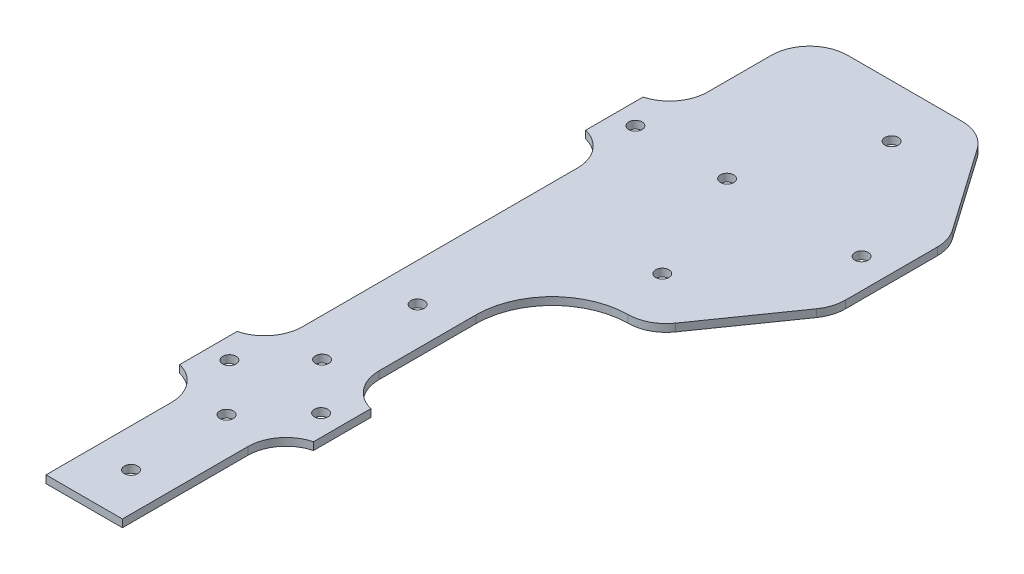
from build123d import *
from OCP.BRepFilletAPI import BRepFilletAPI_MakeChamfer

# Parameters (mm, degrees)
SCHIZZO1_R                   = 1.75
ESTRUSIONE_ESTRUSIONE1_DEPTH = 2
SMUSSO1_SIZE                 = 20
SMUSSO1_SIZE2                = 28.562960135
TAGLIO_ESTRUSIONE1_DEPTH     = 10
RACCORDO1_R                  = 10
RACCORDO2_R                  = 20


with BuildPart() as part:
    # Schizzo1 → Estrusione-Estrusione1 (new body)
    with BuildSketch(Plane(origin=(0, 0, 0), x_dir=(1, 0, 0), z_dir=(0, 1, 0))):
        Polygon((-10, -57.5), (-10, -100), (10, -100), (10, -57.5), (17.5, -57.5), (17.5, -42.5), (10, -42.5), (10, 12.5), (55, 12.5), (55, 100), (10, 100), (-10, 100), (-30, 100), (-30, 12.5), (-10, 12.5), (-10, -42.5), (-17.5, -42.5), (-17.5, -57.5), align=None)
        with Locations(Location((0, -87.75, 0), (0, 0, 270))):
            Circle(SCHIZZO1_R, mode=Mode.SUBTRACT)
        with Locations(Location((0, -62.75, 0), (0, 0, 270))):
            Circle(SCHIZZO1_R, mode=Mode.SUBTRACT)
        with Locations(Location((-12, -50, 0), (0, 0, 270))):
            Circle(SCHIZZO1_R, mode=Mode.SUBTRACT)
        with Locations(Location((0, -37.75, 0), (0, 0, 270))):
            Circle(SCHIZZO1_R, mode=Mode.SUBTRACT)
        with Locations(Location((12, -50, 0), (0, 0, 270))):
            Circle(SCHIZZO1_R, mode=Mode.SUBTRACT)
        with Locations(Location((0, -12.75, 0), (0, 0, 270))):
            Circle(SCHIZZO1_R, mode=Mode.SUBTRACT)
        with Locations(Location((-12, 56.25, 0), (0, 0, 270))):
            Circle(SCHIZZO1_R, mode=Mode.SUBTRACT)
        with Locations(Location((12, 56.25, 0), (0, 0, 270))):
            Circle(SCHIZZO1_R, mode=Mode.SUBTRACT)
        with Locations(Location((25.04, 26.25, 0), (0, 0, 270))):
            Circle(SCHIZZO1_R, mode=Mode.SUBTRACT)
        with Locations(Location((25.04, 86.25, 0), (0, 0, 270))):
            Circle(SCHIZZO1_R, mode=Mode.SUBTRACT)
        with Locations(Location((47.2, 56.25, 0), (0, 0, 270))):
            Circle(SCHIZZO1_R, mode=Mode.SUBTRACT)
    extrude(amount=-ESTRUSIONE_ESTRUSIONE1_DEPTH)

    # Smusso1: one chamfer whose edges measure the first distance from different faces: ONE call of the kernel's chamfer builder (chamfer() names one face for all edges)
    smusso1_edges_1 = [part.edges().sort_by_distance(p)[0] for p in [
        (55, -1, -12.5),
    ]]
    smusso1_side_1 = [part.faces().sort_by_distance(p)[0] for p in [
        (32.5, -1, -12.5),
    ]]
    smusso1_edges_2 = [part.edges().sort_by_distance(p)[0] for p in [
        (55, -1, -100),
    ]]
    smusso1_side_2 = [part.faces().sort_by_distance(p)[0] for p in [
        (12.5, -1, -100),
    ]]
    smusso1 = BRepFilletAPI_MakeChamfer(part.part.solid().wrapped)
    for e in smusso1_edges_1:
        smusso1.Add(SMUSSO1_SIZE, SMUSSO1_SIZE2, e.wrapped, smusso1_side_1[0].wrapped)  # the first distance lies on this face
    for e in smusso1_edges_2:
        smusso1.Add(SMUSSO1_SIZE, SMUSSO1_SIZE2, e.wrapped, smusso1_side_2[0].wrapped)  # the first distance lies on this face
    add(Compound.cast(smusso1.Shape()), mode=Mode.REPLACE)

    # Schizzo2 → Taglio-Estrusione1 (cut)
    with BuildSketch(Plane(origin=(0, 0, 0), x_dir=(1, 0, 0), z_dir=(0, 1, 0))):
        Polygon((-10, 12.5), (-10, 48.75), (-17.5, 48.75), (-17.5, 63.75), (-10.178518111, 63.75), (-10.178518111, 100), (-33.809151811, 100), (-33.809151811, 12.5), align=None)
    extrude(amount=-TAGLIO_ESTRUSIONE1_DEPTH, mode=Mode.SUBTRACT)

    # Raccordo1
    # the kernel refuses this fillet: 10 mm, written as the material it adds along each edge
    with BuildSketch(Plane(origin=(10, 0, 42.5), x_dir=(0, 0, -1), z_dir=(0, -1, 0)), Plane(origin=(-10, 0, 57.5), x_dir=(0, 0, 1), z_dir=(0, -1, 0)), Plane(origin=(-10, 0, -48.75), x_dir=(0, 0, 1), z_dir=(0, -1, 0))) as raccordo1_piece_1:
        with BuildLine():
            CenterArc((9.682458366, 10), RACCORDO1_R, 194.477512186, 75.522487814)
            Line((0, 7.5), (0, 0))
            Line((0, 0), (9.682458366, 0))
        make_face()
    extrude(amount=2)
    with BuildSketch(Plane(origin=(-10, 0, 42.5), x_dir=(-1, 0, 0), z_dir=(0, -1, 0)), Plane(origin=(10, 0, 57.5), x_dir=(1, 0, 0), z_dir=(0, -1, 0))) as raccordo1_piece_2:
        with BuildLine():
            CenterArc((10, 9.682458366), RACCORDO1_R, 180, 75.522487814)
            Line((0, 9.682458366), (0, 0))
            Line((0, 0), (7.5, 0))
        make_face()
    extrude(amount=2)
    with BuildSketch(Plane(origin=(-10.178518111, 0, -63.75), x_dir=(-1, 0, 0), z_dir=(0, -1, 0))) as raccordo1_piece_3:
        with BuildLine():
            CenterArc((10, 9.634601223), RACCORDO1_R, 180, 74.463523002)
            Line((0, 9.634601223), (0, 0))
            Line((0, 0), (7.321481889, 0))
        make_face()
    extrude(amount=2)
    # the kernel refuses this fillet: 10 mm, written as the material it takes off along each edge
    with BuildSketch(Plane(origin=(35, 13.014176264, -12.5), x_dir=(-1, 0, 0), z_dir=(0, -1, 0)), Plane(origin=(35, 13.014176264, -100), x_dir=(0.5735764363510455, 0, 0.8191520442889922), z_dir=(0, -1, 0))) as raccordo1_2_piece_1:
        with BuildLine():
            CenterArc((RACCORDO1_R * 0.520567050552, RACCORDO1_R), RACCORDO1_R, 215, 55)
            Line((-RACCORDO1_R * 0.298584993737, RACCORDO1_R * 0.426423563649), (0, 0))
            Line((0, 0), (RACCORDO1_R * 0.520567050552, 0))
        make_face()
    extrude(amount=28.028352528, mode=Mode.SUBTRACT)
    with BuildSketch(Plane(origin=(55, 7.882469722, -41.062960135), x_dir=(-0.5735764363510429, 0, 0.819152044288994), z_dir=(0, -1, 0)), Plane(origin=(55, 7.882469722, -71.437039865), x_dir=(0, 0, 1), z_dir=(0, -1, 0))) as raccordo1_2_piece_2:
        with BuildLine():
            CenterArc((RACCORDO1_R * 0.315298788879, RACCORDO1_R), RACCORDO1_R, 235, 35)
            Line((-RACCORDO1_R * 0.258277647472, RACCORDO1_R * 0.180847955711), (0, 0))
            Line((0, 0), (RACCORDO1_R * 0.315298788879, 0))
        make_face()
    extrude(amount=17.764939444, mode=Mode.SUBTRACT)
    with BuildSketch(Plane(origin=(-10.178518111, 25, -100), x_dir=(1, 0, 0), z_dir=(0, -1, 0))) as raccordo1_2_piece_3:
        with BuildLine():
            CenterArc((RACCORDO1_R, RACCORDO1_R), RACCORDO1_R, 180, 90)
            Line((0, RACCORDO1_R), (0, 0))
            Line((0, 0), (RACCORDO1_R, 0))
        make_face()
    extrude(amount=52, mode=Mode.SUBTRACT)

    # Raccordo2
    raccordo2_edges = [part.edges().sort_by_distance(p)[0] for p in [
        (10, -1, -12.5),
    ]]
    fillet(raccordo2_edges, radius=RACCORDO2_R)


solid = part.part
